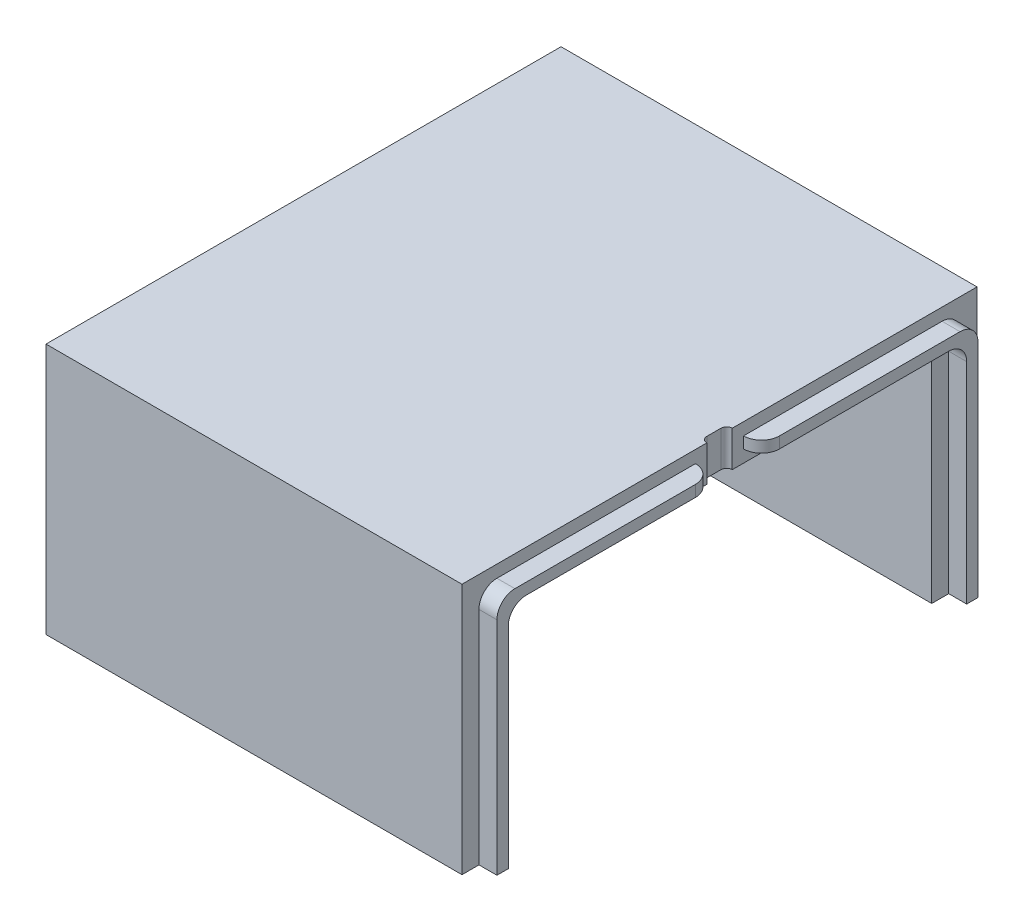
from build123d import *

# Parameters (mm, degrees)
WALL_DEPTH                = 19.05
ROOF_START                = 19.05
ROOF_DEPTH                = 3.175
F_2_56_TAPPED_HOLE1_D     = 1.778
F_2_56_TAPPED_HOLE1_DEPTH = 5.73
F_2_56_TAPPED_HOLE1_TIP   = 0.53416509
BOSS_EXTRUDE1_DEPTH       = 1.5875
FILLET1_R                 = 1.5875


with BuildPart() as part:
    # MainSketch → Wall (new body)
    with BuildSketch(Plane(origin=(0, 0, 0), x_dir=(1, 0, 0), z_dir=(0, 1, 0))):
        Polygon((-32.75, -4), (0, -4), (0, 0), (-36.75, 0), (-36.75, -45.5), (0, -45.5), (0, -41.5), (-32.75, -41.5), align=None)
    extrude(amount=WALL_DEPTH)

    # MainSketch<3> → Roof (add)
    with BuildSketch(Plane(origin=(0, 0, 0), x_dir=(1, 0, 0), z_dir=(0, 1, 0)).offset(ROOF_START)):
        with BuildLine():
            Line((0, -21.625), (0, 0))
            Line((0, 0), (-36.75, 0))
            Line((-36.75, 0), (-36.75, -45.5))
            Line((-36.75, -45.5), (0, -45.5))
            Line((0, -45.5), (0, -23.875))
            ThreePointArc((0, -23.875), (-0.353553391, -23.728553391), (-0.5, -23.375))
            Line((-0.5, -23.375), (-0.5, -22.125))
            ThreePointArc((-0.5, -22.125), (-0.353553391, -21.771446609), (0, -21.625))
        make_face()
    extrude(amount=ROOF_DEPTH)

    # #2-56 Tapped Hole1
    with Locations(Plane(origin=(-18.375, 0, 43), x_dir=(0, 0, -1), z_dir=(0, -1, 0))):
        with Locations((0, 0), (40.5, 0)):
            Hole(F_2_56_TAPPED_HOLE1_D / 2, depth=F_2_56_TAPPED_HOLE1_DEPTH)
            with Locations((0, 0, -(F_2_56_TAPPED_HOLE1_DEPTH + F_2_56_TAPPED_HOLE1_TIP / 2))):  # 118° drill point
                Cone(0, F_2_56_TAPPED_HOLE1_D / 2, F_2_56_TAPPED_HOLE1_TIP, mode=Mode.SUBTRACT)

    # Sketch3 → Boss-Extrude1 (add)
    with BuildSketch(Plane(origin=(0, 0, 0), x_dir=(0, 0, -1), z_dir=(1, 0, 0))):
        Polygon((-44, 21.1375), (-44, 0), (-43, 0), (-43, 20.1375), (-24.875, 20.1375), (-24.875, 21.1375), align=None)
        Polygon((-1.5, 21.1375), (-20.625, 21.1375), (-20.625, 20.1375), (-2.5, 20.1375), (-2.5, 0), (-1.5, 0), align=None)
    extrude(amount=BOSS_EXTRUDE1_DEPTH)

    # Fillet1
    fillet1_edges = [part.edges().sort_by_distance(p)[0] for p in [
        (0.79375, 20.1375, 43),
        (0.79375, 21.1375, 44),
        (0.79375, 20.1375, 2.5),
        (0.79375, 21.1375, 1.5),
        (1.5875, 20.6375, 20.625),
        (1.5875, 20.6375, 24.875),
    ]]
    fillet(fillet1_edges, radius=FILLET1_R - 0.0001)  # a hair under: the kernel refuses the full size


solid = part.part
